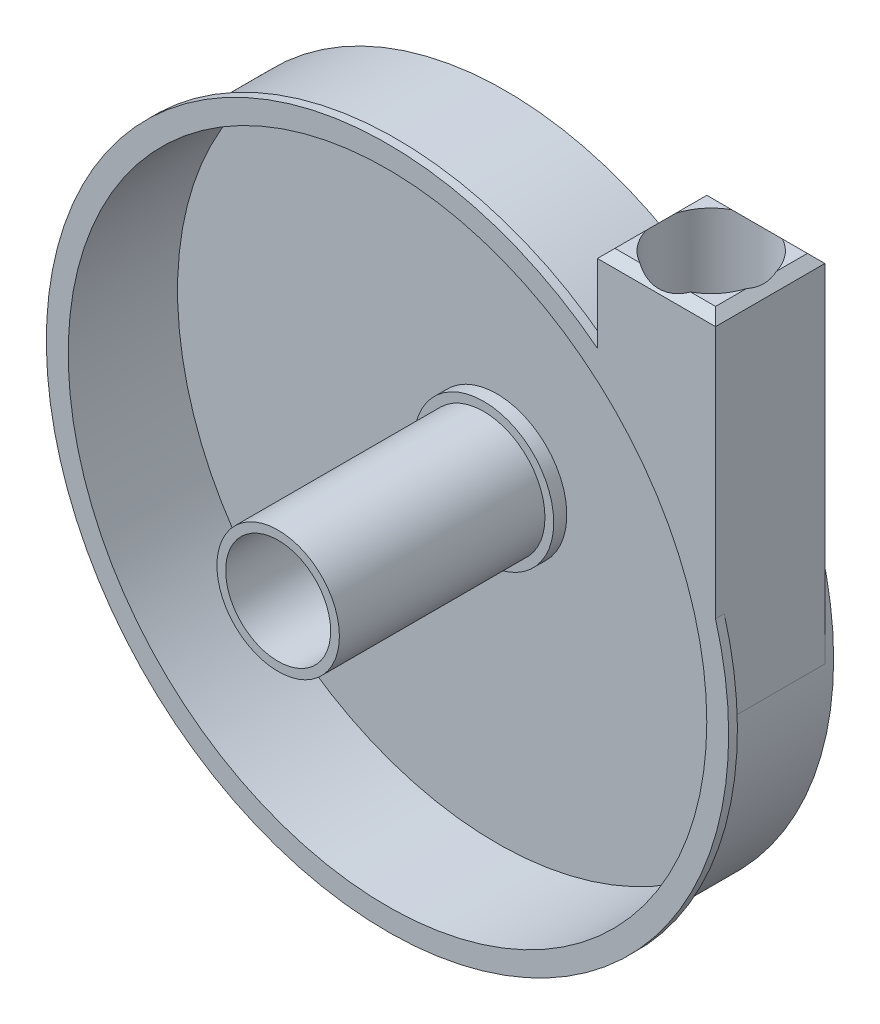
from build123d import *
from build123d.topology import SkipClean

# Parameters (mm, degrees)
SKETCH1_R           = 75
SKETCH1_R_2         = 73
BOSS_EXTRUDE1_DEPTH = 25
BOSS_EXTRUDE2_START = -25
BOSS_EXTRUDE2_DEPTH = 25
SKETCH4_R           = 12
CUT_EXTRUDE2_DEPTH  = 81
BOSS_EXTRUDE3_START = 2
SKETCH5_R           = 75
SKETCH5_R_2         = 12
BOSS_EXTRUDE3_DEPTH = 2
CHAMFER1_SIZE       = 2
SKETCH6_R           = 14
SKETCH6_R_2         = 12
BOSS_EXTRUDE4_DEPTH = 50
SKETCH7_R           = 16
SKETCH7_R_2         = 14
BOSS_EXTRUDE5_DEPTH = 3
BOSS_EXTRUDE6_START = -2
SKETCH8_R           = 78
SKETCH8_R_2         = 75
BOSS_EXTRUDE6_DEPTH = 2


with BuildPart() as part:
    # Sketch1 → Boss-Extrude1 (new body)
    with BuildSketch(Plane.XY):
        Circle(SKETCH1_R)
        Circle(SKETCH1_R_2, mode=Mode.SUBTRACT)
    extrude(amount=BOSS_EXTRUDE1_DEPTH)

    # Sketch2 → Boss-Extrude2 (add)
    with BuildSketch(Plane.XY.offset(25).offset(BOSS_EXTRUDE2_START)):
        with BuildLine():
            Line((75, 81.287132565), (48, 81.287132565))
            Line((48, 81.287132565), (48, 57.628118137))
            ThreePointArc((48, 57.628118137), (67.915388536, 31.819805153), (75, 0))
            Line((75, 0), (75, 81.287132565))
        make_face()
    extrude(amount=BOSS_EXTRUDE2_DEPTH)

    # Sketch4 → Cut-Extrude2 (cut)
    with BuildSketch(Plane(origin=(0, 81.287132565, 0), x_dir=(1, 0, 0), z_dir=(0, 1, 0))):
        with Locations(Location((61.5, -12.5, 0), (0, 0, 270))):
            Circle(SKETCH4_R)
    extrude(amount=-CUT_EXTRUDE2_DEPTH, mode=Mode.SUBTRACT)

    # Sketch5 → Boss-Extrude3 (add)
    with BuildSketch(Plane(origin=(0, 0, 0), x_dir=(-1, 0, 0), z_dir=(0, 0, -1)).offset(BOSS_EXTRUDE3_START)):
        Circle(SKETCH5_R)
        Circle(SKETCH5_R_2, mode=Mode.SUBTRACT)
    extrude(amount=-BOSS_EXTRUDE3_DEPTH)

    # Chamfer1
    # the kernel refuses this chamfer: 2 mm, written as the material it takes off along each edge
    with BuildSketch(Plane(origin=(75, 81.287132565, -5.143365976), x_dir=(0.027495876610589005, -0.9996219169112968, 0), z_dir=(0, 0, 1))) as chamfer1_piece_1:
        Polygon((CHAMFER1_SIZE * 0.999621916911, -CHAMFER1_SIZE * 0.0274958766106), (-CHAMFER1_SIZE * 0.0274958766106, -CHAMFER1_SIZE * 0.999621916911), (0, 0), align=None)
    extrude(amount=35.286731952, mode=Mode.SUBTRACT)
    with BuildSketch(Plane(origin=(48, 81.287132565, -5.143365976), x_dir=(-0.02749587661058555, -0.9996219169112968, 0), z_dir=(0, 0, 1))) as chamfer1_piece_2:
        Polygon((CHAMFER1_SIZE * 0.999621916911, CHAMFER1_SIZE * 0.0274958766106), (-CHAMFER1_SIZE * 0.0274958766106, CHAMFER1_SIZE * 0.999621916911), (0, 0), align=None)
    extrude(amount=35.286731952, mode=Mode.SUBTRACT)
    with BuildSketch(Plane(origin=(80.143365976, 81.287132565, 25), x_dir=(0, -0.9996219169112968, 0.02749587661058555), z_dir=(-1, 0, 0)), Plane(origin=(80.143365976, 81.287132565, 0), x_dir=(0, 0.02749587661058908, 0.9996219169112968), z_dir=(-1, 0, 0))) as chamfer1_piece_3:
        Polygon((CHAMFER1_SIZE * 0.999621916911, -CHAMFER1_SIZE * 0.0274958766106), (-CHAMFER1_SIZE * 0.0274958766106, -CHAMFER1_SIZE * 0.999621916911), (0, 0), align=None)
    extrude(amount=37.286731952, mode=Mode.SUBTRACT)

    # Sketch6 → Boss-Extrude4 (add)
    with SkipClean():  # the faces are left unmerged after this step: merging them gives an invalid solid
        with BuildSketch(Plane.XY):
            with Locations(Location((0, 0, 0), (0, 0, 180))):
                Circle(SKETCH6_R)
            Circle(SKETCH6_R_2, mode=Mode.SUBTRACT)
        extrude(amount=BOSS_EXTRUDE4_DEPTH)
    add(part.part.scale(1), mode=Mode.REPLACE)  # the faces are merged on a copy

    # Sketch7 → Boss-Extrude5 (add)
    with BuildSketch(Plane.XY):
        with Locations(Location((0, 0, 0), (0, 0, 180))):
            Circle(SKETCH7_R)
        Circle(SKETCH7_R_2, mode=Mode.SUBTRACT)
    extrude(amount=BOSS_EXTRUDE5_DEPTH)

    # Sketch8 → Boss-Extrude6 (add)
    with SkipClean():  # the faces are left unmerged after this step: merging them gives an invalid solid
        with BuildSketch(Plane.XY.offset(25).offset(BOSS_EXTRUDE6_START)):
            Circle(SKETCH8_R)
            with Locations(Location((0, 0, 0), (0, 0, 180))):
                Circle(SKETCH8_R_2, mode=Mode.SUBTRACT)
        extrude(amount=BOSS_EXTRUDE6_DEPTH)


solid = part.part
